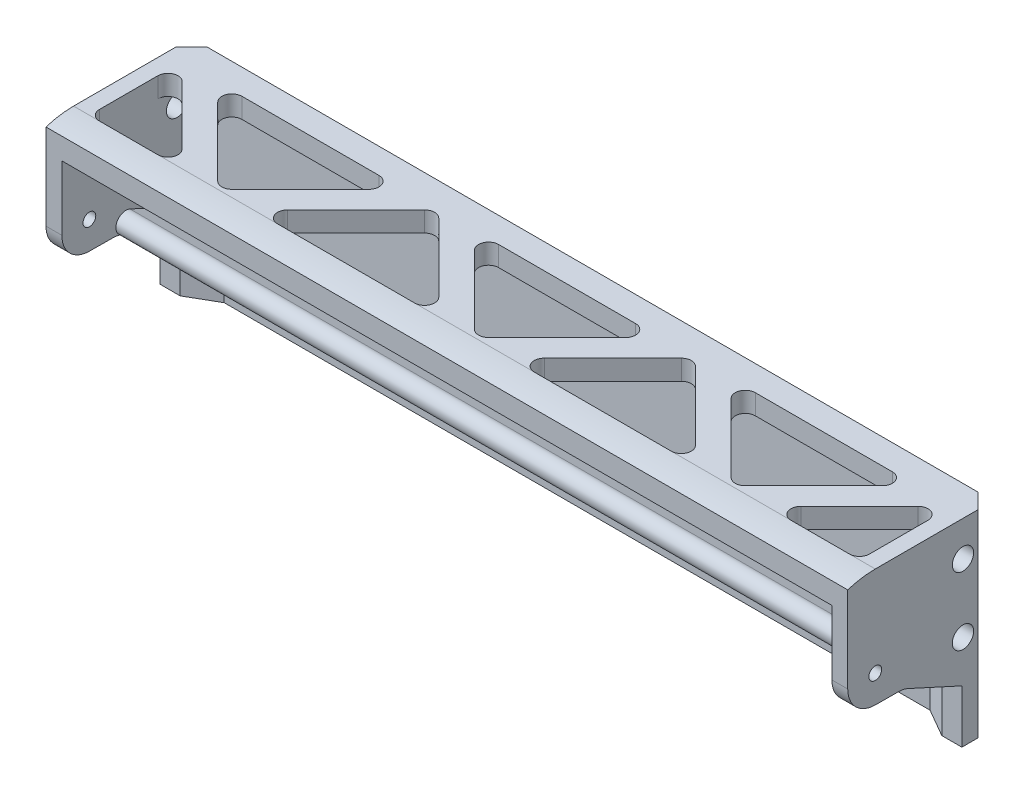
from build123d import *

# Parameters (mm, degrees)
SKETCH1_R           = 3.3782
SKETCH1_R_2         = 2.0193
BOSS_EXTRUDE1_DEPTH = 5.017000126
BOSS_EXTRUDE2_START = 121.982999874
BOSS_EXTRUDE2_DEPTH = 121.982999874
BOSS_EXTRUDE3_REACH = 146.947
CHAMFER1_SIZE       = 4.826
FILLET1_R           = 3.175
CUT_EXTRUDE1_DEPTH  = 260.552159764
FILLET2_R           = 3.175


with BuildPart() as part:
    # Sketch1 → Boss-Extrude1 (new body)
    with BuildSketch(Plane(origin=(0, 0, 0), x_dir=(0, 0, -1), z_dir=(1, 0, 0))):
        with BuildLine():
            ThreePointArc((17.267409525, 39.723483692), (18.59285001, 39.573142424), (19.857637877, 39.149224239))
            Line((19.857637877, 39.149224239), (42.164, 28.956))
            Line((42.164, 28.956), (42.164, 14.4653))
            Line((42.164, 14.4653), (46.99, 14.4653))
            Line((46.99, 14.4653), (46.99, 77.089))
            Line((46.99, 77.089), (9.62025, 77.089))
            ThreePointArc((9.62025, 77.089), (5.201472483, 76.745277517), (0.889, 75.722379195))
            Line((0.889, 75.722379195), (0.889, 48.514))
            ThreePointArc((0.889, 48.514), (3.422551022, 42.363938704), (9.552880645, 39.783009911))
            Line((9.552880645, 39.783009911), (17.267409525, 39.723483692))
        make_face()
        with Locations((37.4015, 44.4881)):
            Circle(SKETCH1_R, mode=Mode.SUBTRACT)
        with Locations((9.62025, 48.514)):
            Circle(SKETCH1_R_2, mode=Mode.SUBTRACT)
        with Locations((37.4015, 65.9765)):
            Circle(SKETCH1_R, mode=Mode.SUBTRACT)
    extrude(amount=-BOSS_EXTRUDE1_DEPTH)

    # Sketch2 → Boss-Extrude2 (add)
    with BuildSketch(Plane(origin=(0, 0, 0), x_dir=(0, 0, -1), z_dir=(1, 0, 0)).offset(BOSS_EXTRUDE2_START)):
        with BuildLine():
            Line((42.164, 35.93758433), (22.496862123, 44.924775761))
            ThreePointArc((22.496862123, 44.924775761), (18.289474239, 43.356612123), (19.857637877, 39.149224239))
            Line((19.857637877, 39.149224239), (42.164, 28.956))
            Line((42.164, 28.956), (42.164, 14.4653))
            Line((42.164, 14.4653), (46.99, 14.4653))
            Line((46.99, 14.4653), (46.99, 77.089))
            Line((46.99, 77.089), (9.62025, 77.089))
            ThreePointArc((9.62025, 77.089), (5.201472483, 76.745277517), (0.889, 75.722379195))
            Line((0.889, 75.722379195), (0.889, 68.952099188))
            ThreePointArc((0.889, 68.952099188), (5.164137875, 70.287692607), (9.62025, 70.739))
            Line((9.62025, 70.739), (42.164, 70.739))
            Line((42.164, 70.739), (42.164, 35.93758433))
        make_face()
    extrude(amount=-BOSS_EXTRUDE2_DEPTH)

    # Boss-Extrude3: up to this plane
    boss_extrude3_end = Plane(origin=(-5.017000126, 39.893111336, -18.2297511), z_dir=(0, -0.909535672675175, 0.41562586557060793))
    # Sketch5 → Boss-Extrude3 (add, up to the surface)
    with BuildSketch(Plane.XZ.offset(-14.4653), mode=Mode.PRIVATE) as boss_extrude3_sk1:
        Polygon((10.174135521, -42.164), (1.332999942, -37.059567994), (-5.017000126, -37.059567994), (-5.017000126, -42.164), align=None)
    boss_extrude3_tool1 = split(extrude(boss_extrude3_sk1.sketch, amount=-BOSS_EXTRUDE3_REACH, mode=Mode.PRIVATE), bisect_by=boss_extrude3_end, keep=Keep.BOTH, mode=Mode.PRIVATE)
    add(boss_extrude3_tool1.solids().sort_by_distance((0.670673, 14.4653, -39.960953))[0])

    # Mirror1: part across plane


with BuildPart() as part_1:
    add(part.part)
    add(part.part.mirror(Plane(origin=(121.982999874, 0, 0), x_dir=(0, 0, 1), z_dir=(1, 0, 0))))

    # Chamfer1
    chamfer1_edges = [part_1.edges().sort_by_distance(p)[0] for p in [
        (248.982999874, 45.77715, -46.99),
        (-5.017000126, 45.77715, -46.99),
    ]]
    chamfer(chamfer1_edges, length=CHAMFER1_SIZE)

    # Fillet1
    fillet1_edges = [part_1.edges().sort_by_distance(p)[0] for p in [
        (121.982999874, 35.93758433, -42.164),
        (121.982999874, 70.739, -42.164),
    ]]
    fillet(fillet1_edges, radius=FILLET1_R)

    # Sketch9 → Cut-Extrude1 (cut, through all)
    with BuildSketch(Plane.XZ.offset(-70.739)):
        Polygon((0, -9.62025), (0, -38.989), (29.36875, -9.62025), align=None)
        Polygon((11.292249958, -38.989), (40.660999958, -9.62025), (70.029749958, -38.989), align=None)
        Polygon((51.953249916, -9.62025), (81.321999916, -38.989), (110.690749916, -9.62025), align=None)
        Polygon((121.982999874, -9.62025), (92.614249874, -38.989), (121.982999874, -38.989), align=None)
    cut_extrude1 = extrude(amount=-CUT_EXTRUDE1_DEPTH, mode=Mode.SUBTRACT)

    # Mirror2: Cut-Extrude1 across plane
    add(cut_extrude1.mirror(Plane(origin=(121.982999874, 77.089, -38.989), x_dir=(0, 0, 1), z_dir=(1, 0, 0))), mode=Mode.SUBTRACT)

    # Fillet2
    fillet2_edges = [part_1.edges().sort_by_distance(p)[0] for p in [
        (0, 73.914, -38.989),
        (0, 73.914, -9.62025),
        (11.292249958, 73.914, -38.989),
        (70.029749958, 73.914, -38.989),
        (40.660999958, 73.914, -9.62025),
        (81.321999916, 73.914, -38.989),
        (51.953249916, 73.914, -9.62025),
        (110.690749916, 73.914, -9.62025),
        (92.614249874, 73.914, -38.989),
        (151.351749874, 73.914, -38.989),
        (121.982999874, 73.914, -9.62025),
        (162.643999832, 73.914, -38.989),
        (133.275249832, 73.914, -9.62025),
        (192.012749832, 73.914, -9.62025),
        (173.93624979, 73.914, -38.989),
        (203.30499979, 73.914, -9.62025),
        (232.67374979, 73.914, -38.989),
        (243.965999748, 73.914, -38.989),
        (214.597249748, 73.914, -9.62025),
        (243.965999748, 73.914, -9.62025),
        (29.36875, 73.914, -9.62025),
    ]]
    fillet(fillet2_edges, radius=FILLET2_R)


solid = part_1.part
